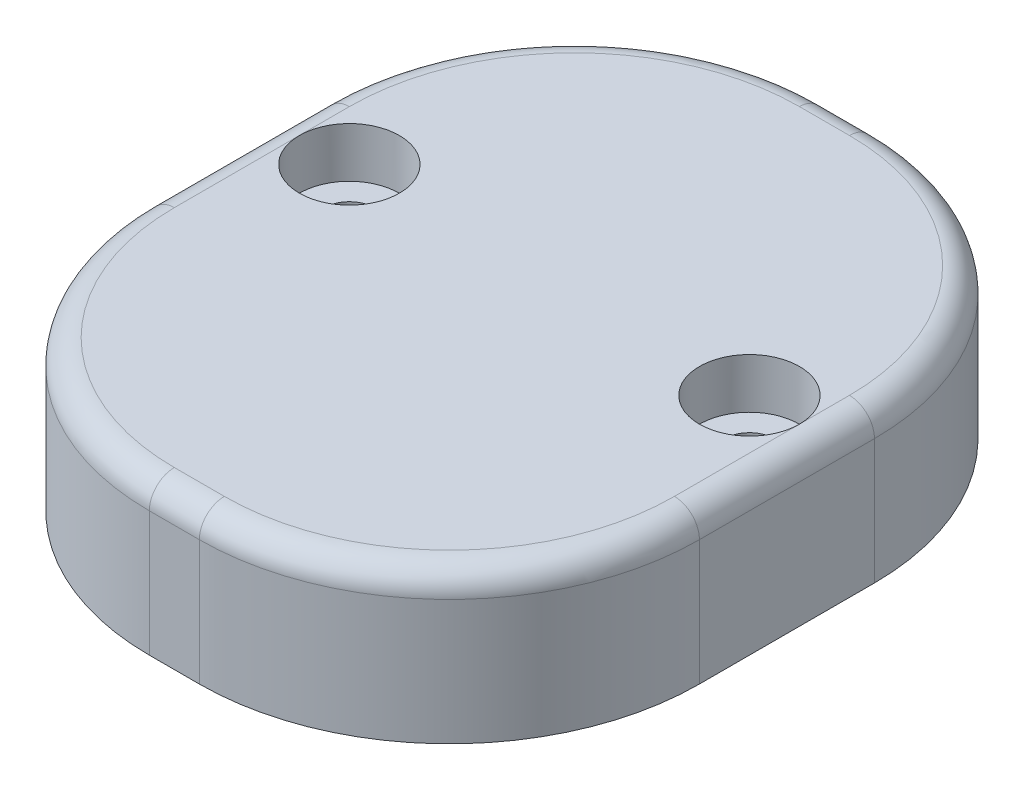
from build123d import *

# Parameters (mm, degrees)
BOSS_EXTRU_1_DEPTH                                 = 22
ESQUISSE2_W                                        = 22
ESQUISSE2_H                                        = 6
BOSS_EXTRU_2_DEPTH                                 = 5
CHAMBRAGE_POUR_VIS_T_TE_HEXAGONALE_M21_D           = 2
CHAMBRAGE_POUR_VIS_T_TE_HEXAGONALE_M21_CBORE_D     = 4
CHAMBRAGE_POUR_VIS_T_TE_HEXAGONALE_M21_CBORE_DEPTH = 2
CONG_1_R                                           = 10
CONG_2_R                                           = 1


# Some blends are built 0.0001 mm under size
with BuildPart() as part:
    # Esquisse1 → Boss.-Extru.1 (new body)
    with BuildSketch(Plane.XY):
        with BuildLine():
            Line((0, 6), (0, 0))
            Line((0, 0), (6, 0))
            ThreePointArc((6, 0), (11, 5), (16, 0))
            Line((16, 0), (22, 0))
            Line((22, 0), (22, 6))
            Line((22, 6), (0, 6))
        make_face()
    extrude(amount=BOSS_EXTRU_1_DEPTH)

    # Esquisse2 → Boss.-Extru.2 (add)
    with BuildSketch(Plane.XY.offset(22)):
        with Locations((11, 3)):
            Rectangle(ESQUISSE2_W, ESQUISSE2_H)
    extrude(amount=BOSS_EXTRU_2_DEPTH)

    # Chambrage pour vis à tête hexagonale M21 (through all)
    with Locations(Plane(origin=(0, 6, 0), x_dir=(1, 0, 0), z_dir=(0, 1, 0))):
        with Locations((19, -12), (3, -12)):
            CounterBoreHole(CHAMBRAGE_POUR_VIS_T_TE_HEXAGONALE_M21_D / 2, CHAMBRAGE_POUR_VIS_T_TE_HEXAGONALE_M21_CBORE_D / 2, CHAMBRAGE_POUR_VIS_T_TE_HEXAGONALE_M21_CBORE_DEPTH)

    # Congé1
    # the kernel refuses this fillet: 10 mm, written as the material it takes off along each edge
    with BuildSketch(Plane(origin=(0, 31, 0), x_dir=(0, 0, 1), z_dir=(0, -1, 0)), Plane(origin=(22, -25, 27), x_dir=(-1, 0, 0), z_dir=(0, 1, 0))) as cong_1_piece_1:
        with BuildLine():
            CenterArc((CONG_1_R, -CONG_1_R), CONG_1_R, 90, 90)
            Line((0, -CONG_1_R), (0, 0))
            Line((0, 0), (CONG_1_R, 0))
        make_face()
    extrude(amount=56, mode=Mode.SUBTRACT)
    with BuildSketch(Plane(origin=(0, 31, 27), x_dir=(0, 0, -1), z_dir=(0, -1, 0)), Plane(origin=(22, -25, 0), x_dir=(-1, 0, 0), z_dir=(0, 1, 0))) as cong_1_piece_2:
        with BuildLine():
            CenterArc((CONG_1_R, CONG_1_R), CONG_1_R, 180, 90)
            Line((0, CONG_1_R), (0, 0))
            Line((0, 0), (CONG_1_R, 0))
        make_face()
    extrude(amount=56, mode=Mode.SUBTRACT)

    # Congé2
    cong_2_edges = [part.edges().sort_by_distance(p)[0] for p in [
        (11, 6, 0),
        (0, 6, 13.5),
        (11, 6, 27),
        (22, 6, 13.5),
        (19.071067812, 6, 24.071067812),
        (19.071067812, 6, 2.928932188),
        (2.928932188, 6, 24.071067812),
        (2.928932188, 6, 2.928932188),
    ]]
    fillet(cong_2_edges, radius=CONG_2_R - 0.0001)  # a hair under: the kernel refuses the full size


solid = part.part
